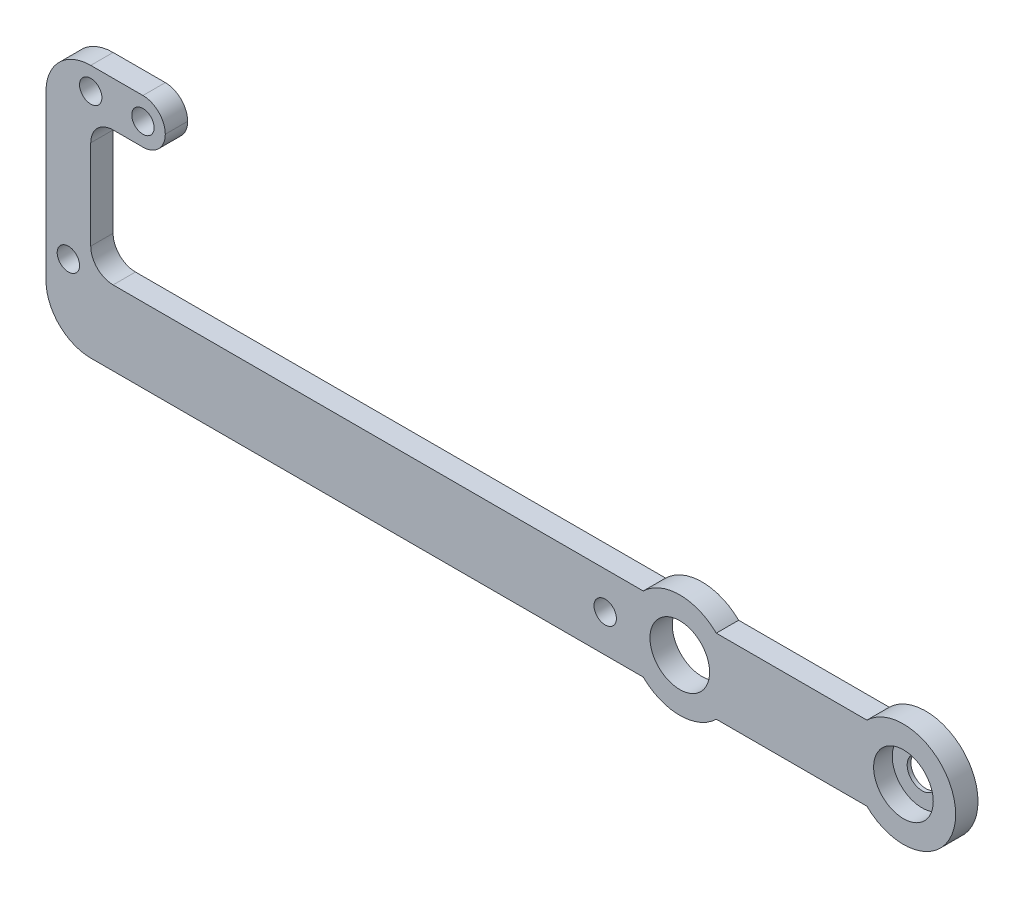
from build123d import *

# Parameters (mm, degrees)
EXTRUDE_1_DEPTH     = 3
SKETCH_3_R          = 4
CUT_EXTRUDE_1_DEPTH = 2.5
FILLET_START        = -1
FILLET_1_DEPTH      = 5
FILLET_1_2_DEPTH    = 3
FILLET_2_R          = 6
SKETCH_4_R          = 4
CUT_EXTRUDE_2_DEPTH = 4
SKETCH_5_R          = 1.5
CUT_EXTRUDE_4_DEPTH = 10
SKETCH_6_R          = 2
CUT_EXTRUDE_5_DEPTH = 10


with BuildPart() as part:
    # 草图1 → 凸台-拉伸1 (new body)
    with BuildSketch(Plane.XY):
        with BuildLine():
            Line((0, 0), (80.101020514, 0))
            ThreePointArc((80.101020514, 0), (85, -2), (89.898979486, 0))
            Line((89.898979486, 0), (110.101020514, 0))
            ThreePointArc((110.101020514, 0), (122, 5), (110.101020514, 10))
            Line((110.101020514, 10), (89.898979486, 10))
            ThreePointArc((89.898979486, 10), (85, 12), (80.101020514, 10))
            Line((80.101020514, 10), (6, 10))
            Line((6, 10), (6, 28))
            Line((6, 28), (16, 28))
            Line((16, 28), (16, 34))
            Line((16, 34), (0, 34))
            Line((0, 34), (0, 0))
        make_face()
    extrude(amount=EXTRUDE_1_DEPTH)

    # 草图3 → 切除-拉伸1 (cut)
    with BuildSketch(Plane.XY.offset(3)):
        with Locations((115, 5)):
            Circle(SKETCH_3_R)
    extrude(amount=-CUT_EXTRUDE_1_DEPTH, mode=Mode.SUBTRACT)

    # 圆角1: read off the stored shape, not the designer's step
    # 圆角1 outline → 圆角1 (cut)
    with BuildSketch(Plane.XY.offset(FILLET_START)):
        with BuildLine():
            ThreePointArc((13, 34), (15.121320344, 33.121320344), (16, 31))
            Line((16, 31), (16, 34))
            Line((16, 34), (13, 34))
        make_face()
        with BuildLine():
            ThreePointArc((16, 31), (15.121320344, 28.878679656), (13, 28))
            Line((13, 28), (16, 28))
            Line((16, 28), (16, 31))
        make_face()
    extrude(amount=FILLET_1_DEPTH, mode=Mode.SUBTRACT)

    # Fillet 1 2 outline → Fillet 1 2 (add)
    with BuildSketch(Plane.XY):
        with BuildLine():
            Line((6, 28), (6, 25))
            ThreePointArc((6, 25), (6.878679656, 27.121320344), (9, 28))
            Line((9, 28), (6, 28))
        make_face()
        with BuildLine():
            ThreePointArc((9, 10), (6.878679656, 10.878679656), (6, 13))
            Line((6, 13), (6, 10))
            Line((6, 10), (9, 10))
        make_face()
    extrude(amount=FILLET_1_2_DEPTH)

    # 圆角2
    fillet_2_edges = [part.edges().sort_by_distance(p)[0] for p in [
        (0, 34, 1.5),
        (0, 0, 1.5),
    ]]
    fillet(fillet_2_edges, radius=FILLET_2_R)

    # 草图4 → 切除-拉伸2 (cut)
    with BuildSketch(Plane.XY.offset(3)):
        with Locations((85, 5)):
            Circle(SKETCH_4_R)
    extrude(amount=-CUT_EXTRUDE_2_DEPTH, mode=Mode.SUBTRACT)

    # 草图5 → 切除-拉伸4 (cut)
    with BuildSketch(Plane.XY):
        with Locations((75, 5)):
            Circle(SKETCH_5_R)
        with Locations((3, 10)):
            Circle(SKETCH_5_R)
        with Locations((13, 31)):
            Circle(SKETCH_5_R)
        with Locations((6, 31)):
            Circle(SKETCH_5_R)
    extrude(amount=CUT_EXTRUDE_4_DEPTH, mode=Mode.SUBTRACT)

    # 草图6 → 切除-拉伸5 (cut)
    with BuildSketch(Plane(origin=(0, 0, 0), x_dir=(-1, 0, 0), z_dir=(0, 0, -1))):
        with Locations((-115, 5)):
            Circle(SKETCH_6_R)
    extrude(amount=-CUT_EXTRUDE_5_DEPTH, mode=Mode.SUBTRACT)


solid = part.part
